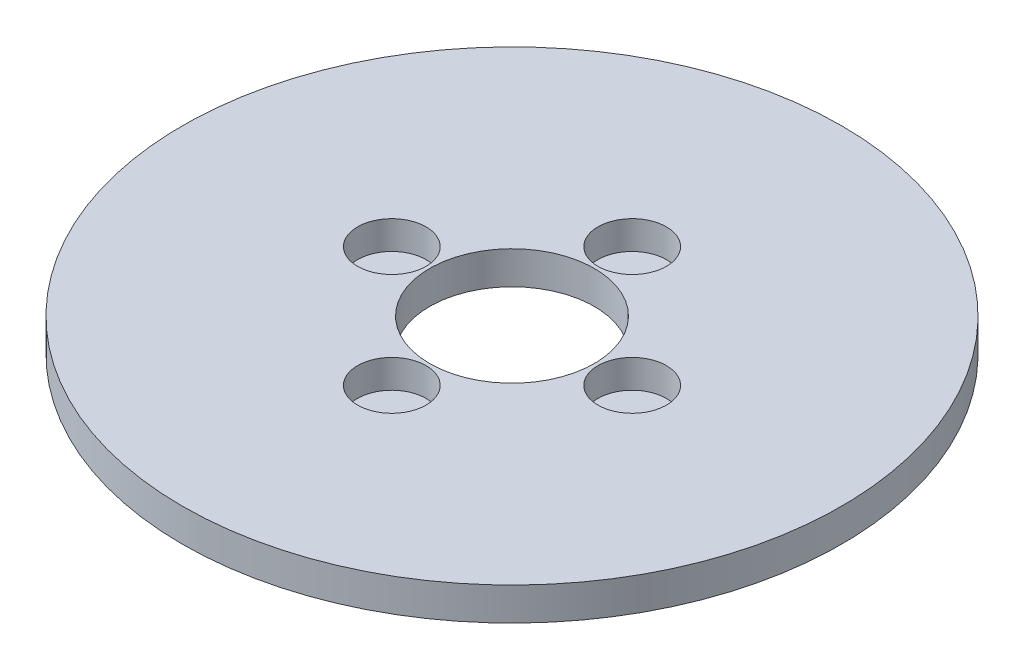
from build123d import *

# Parameters (mm, degrees)
SKETCH1_R           = 40
BOSS_EXTRUDE1_DEPTH = 4
SKETCH2_R           = 10
CUT_EXTRUDE1_DEPTH  = 57.709787515
SKETCH3_R           = 4.156311898
CUT_EXTRUDE2_DEPTH  = 3.449733719
CIRPATTERN1_COUNT   = 4


with BuildPart() as part:
    # Sketch1 → Boss-Extrude1 (new body)
    with BuildSketch(Plane(origin=(0, 0, 0), x_dir=(1, 0, 0), z_dir=(0, 1, 0))):
        Circle(SKETCH1_R)
    extrude(amount=BOSS_EXTRUDE1_DEPTH)

    # Sketch2 → Cut-Extrude1 (cut, through all)
    with BuildSketch(Plane(origin=(0, 0, 0), x_dir=(1, 0, 0), z_dir=(0, 1, 0))):
        Circle(SKETCH2_R)
    extrude(amount=CUT_EXTRUDE1_DEPTH, mode=Mode.SUBTRACT)

    # Sketch3 → Cut-Extrude2 (cut)
    with BuildSketch(Plane(origin=(0, 4, 0), x_dir=(1, 0, 0), z_dir=(0, 1, 0))):
        with Locations((-14.587520601, 0)):
            Circle(SKETCH3_R)
    cut_extrude2 = extrude(amount=-CUT_EXTRUDE2_DEPTH, mode=Mode.SUBTRACT)

    # CirPattern1: Cut-Extrude2 ×4 about axis
    cirpattern1_axis = Axis((0, 0, 0), (0, 1, 0))
    for i in range(1, CIRPATTERN1_COUNT):
        add(cut_extrude2.rotate(cirpattern1_axis, i * 360 / CIRPATTERN1_COUNT), mode=Mode.SUBTRACT)


solid = part.part
